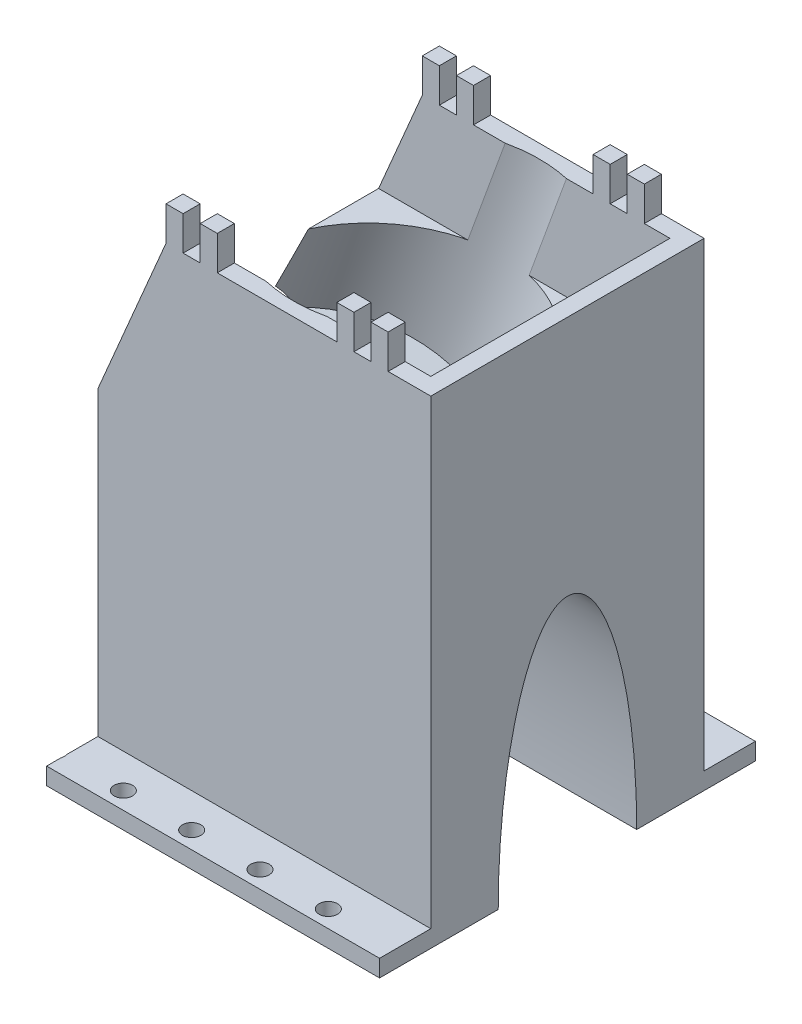
from build123d import *

# Parameters (mm, degrees)
SKETCH1_W                = 228.6
SKETCH1_H                = 177.8
BOSS_EXTRUDE1_DEPTH      = 50.8
SKETCH13_W               = 6.35
SKETCH13_H               = 6.35
BOSS_EXTRUDE3_DEPTH      = 12.7
SKETCH22_W               = 25.4
SKETCH22_H               = 101.6
CUT_EXTRUDE17_DEPTH      = 232.753252404
SKETCH21_W               = 31.75
SKETCH21_H               = 101.6
CUT_EXTRUDE16_DEPTH      = 218.388983162
SKETCH26_W               = 158.75
SKETCH26_H               = 88.9
CUT_EXTRUDE21_DEPTH      = 38.1
SKETCH30_RX              = 87.987697086
SKETCH30_RY              = 25.736582258
CUT_EXTRUDE25_DEPTH      = 253.167766576
SKETCH31_W               = 171.45
SKETCH31_H               = 19.05
SKETCH31_R               = 3.429
BOSS_EXTRUDE4_DEPTH      = 6.35
CUT_EXTRUDE26_DEPTH      = 223.612561578
CUT_EXTRUDE26_DEPTH_BACK = 223.612561578
CUT_EXTRUDE27_DEPTH      = 223.612561578
CUT_EXTRUDE27_DEPTH_BACK = 223.612561578
SKETCH33_W               = 92.505401116
SKETCH33_H               = 152.119992947


with BuildPart() as part:
    # Sketch1 → Boss-Extrude1 (new, symmetric)
    with BuildSketch(Plane.XY):
        with Locations((-25.4, -88.9)):
            Rectangle(SKETCH1_W, SKETCH1_H)
    extrude(amount=BOSS_EXTRUDE1_DEPTH, both=True)

    # Sketch2 → Cut-Revolve1 (revolve, cut)
    with BuildSketch(Plane.XY):
        Polygon((-62.474965321, -71.703364667), (-72.4996062, -68.054693778), (-48.654207758, -2.54), (0, 131.136337175), (2.912683974, 139.138870624), (44.68317762, 120.22602154), (0, -2.54), (-50.887528012, -142.352334146), (-62.534607273, -174.352421417), (-87.258984733, -242.282090199), (-120.197090477, -230.293600135), align=None)
    revolve(axis=Axis((-60.4239625, -168.553472561, 0), (0.3420201433256658, 0.9396926207859095, 0)), mode=Mode.SUBTRACT)

    # Sketch13 → Boss-Extrude3 (add)
    with BuildSketch(Plane(origin=(0, 0, 0), x_dir=(1, 0, 0), z_dir=(0, 1, 0))):
        with Locations((-38.1, 47.625)):
            Rectangle(SKETCH13_W, SKETCH13_H)
        with Locations((-25.4, 47.625)):
            Rectangle(SKETCH13_W, SKETCH13_H)
        with Locations((25.4, 47.625)):
            Rectangle(SKETCH13_W, SKETCH13_H)
        with Locations((38.1, 47.625)):
            Rectangle(SKETCH13_W, SKETCH13_H)
        with Locations((38.1, -47.625)):
            Rectangle(SKETCH13_W, SKETCH13_H)
        with Locations((25.4, -47.625)):
            Rectangle(SKETCH13_W, SKETCH13_H)
        with Locations((-25.4, -47.625)):
            Rectangle(SKETCH13_W, SKETCH13_H)
        with Locations((-38.1, -47.625)):
            Rectangle(SKETCH13_W, SKETCH13_H)
    extrude(amount=BOSS_EXTRUDE3_DEPTH)

    # Sketch22 → Cut-Extrude17 (cut, through all)
    with BuildSketch(Plane(origin=(0, 0, 0), x_dir=(1, 0, 0), z_dir=(0, 1, 0))):
        with Locations((-127, 0)):
            Rectangle(SKETCH22_W, SKETCH22_H)
    extrude(amount=-CUT_EXTRUDE17_DEPTH, mode=Mode.SUBTRACT)

    # Sketch21 → Cut-Extrude16 (cut, through all)
    with BuildSketch(Plane(origin=(0, 0, 0), x_dir=(1, 0, 0), z_dir=(0, 1, 0))):
        with Locations((73.025, 0)):
            Rectangle(SKETCH21_W, SKETCH21_H)
    extrude(amount=-CUT_EXTRUDE16_DEPTH, mode=Mode.SUBTRACT)

    # Sketch26 → Cut-Extrude21 (cut)
    with BuildSketch(Plane(origin=(0, 0, 0), x_dir=(1, 0, 0), z_dir=(0, 1, 0))):
        with Locations((-28.575, 0)):
            Rectangle(SKETCH26_W, SKETCH26_H)
    extrude(amount=-CUT_EXTRUDE21_DEPTH, mode=Mode.SUBTRACT)

    # Sketch30 → Cut-Extrude25 (cut, through all)
    with BuildSketch(Plane.ZY.offset(114.3)):
        with Locations(Location((0, -177.8), (0, 0, -90))):
            Ellipse(SKETCH30_RX, SKETCH30_RY)
    extrude(amount=-CUT_EXTRUDE25_DEPTH, mode=Mode.SUBTRACT)

    # Sketch31 → Boss-Extrude4 (add)
    # profile 1 of 2: a face of its own
    with BuildSketch(Plane.XZ.offset(177.8)):
        with Locations((-28.575, 60.325)):
            Rectangle(SKETCH31_W, SKETCH31_H)
        with Locations((-95.25, 63.5)):
            Circle(SKETCH31_R, mode=Mode.SUBTRACT)
        with Locations((-69.85, 63.5)):
            Circle(SKETCH31_R, mode=Mode.SUBTRACT)
        with Locations((-44.45, 63.5)):
            Circle(SKETCH31_R, mode=Mode.SUBTRACT)
        with Locations((-19.05, 63.5)):
            Circle(SKETCH31_R, mode=Mode.SUBTRACT)
        with Locations((6.35, 63.5)):
            Circle(SKETCH31_R, mode=Mode.SUBTRACT)
        with Locations((31.75, 63.5)):
            Circle(SKETCH31_R, mode=Mode.SUBTRACT)
    # profile 2 of 2: a face of its own
    with BuildSketch(Plane.XZ.offset(177.8)):
        with Locations((-28.575, -60.325)):
            Rectangle(SKETCH31_W, SKETCH31_H)
        with Locations((-69.85, -63.5)):
            Circle(SKETCH31_R, mode=Mode.SUBTRACT)
        with Locations((-44.45, -63.5)):
            Circle(SKETCH31_R, mode=Mode.SUBTRACT)
        with Locations((-19.05, -63.5)):
            Circle(SKETCH31_R, mode=Mode.SUBTRACT)
        with Locations((6.35, -63.5)):
            Circle(SKETCH31_R, mode=Mode.SUBTRACT)
        with Locations((31.75, -63.5)):
            Circle(SKETCH31_R, mode=Mode.SUBTRACT)
        with Locations((-95.25, -63.5)):
            Circle(SKETCH31_R, mode=Mode.SUBTRACT)
    extrude(amount=-BOSS_EXTRUDE4_DEPTH)

    # Sketch32 → Cut-Extrude26 (cut, two sides: drawn at the far end of the back side and taken through both)
    with BuildSketch(Plane.XY.offset(-CUT_EXTRUDE26_DEPTH_BACK)):
        Polygon((-41.275, 0), (-114.3, -171.45), (-114.3, 0), align=None)
    extrude(amount=CUT_EXTRUDE26_DEPTH + CUT_EXTRUDE26_DEPTH_BACK, mode=Mode.SUBTRACT)

    # Sketch33 → Cut-Extrude27 (cut, two sides: drawn at the far end of the back side and taken through both)
    with BuildSketch(Plane.XY.offset(-CUT_EXTRUDE27_DEPTH_BACK)):
        with Locations((-112.857698795, -107.37630669)):
            Rectangle(SKETCH33_W, SKETCH33_H)
    extrude(amount=CUT_EXTRUDE27_DEPTH + CUT_EXTRUDE27_DEPTH_BACK, mode=Mode.SUBTRACT)


solid = part.part
